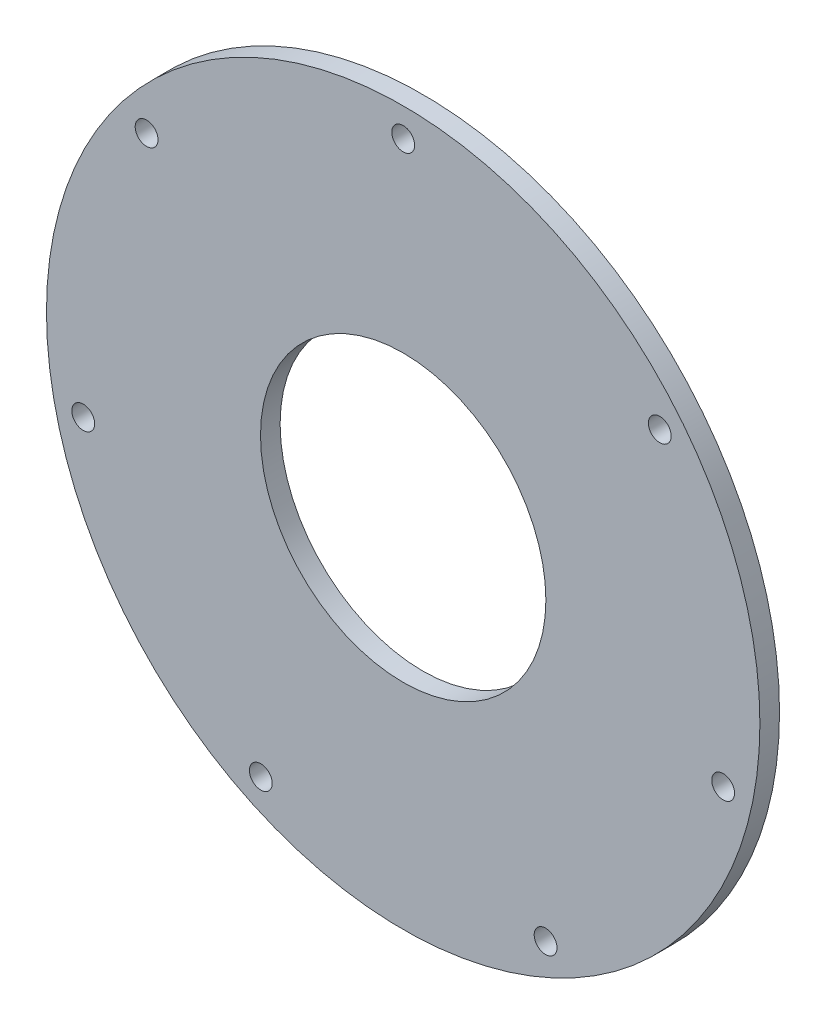
from build123d import *

# Parameters (mm, degrees)
SKIZZE1_R                        = 50
SKIZZE1_R_2                      = 20
AUFSATZ_LINEAR_AUSTRAGEN1_DEPTH  = 2.75
F_3_2_3_2_DURCHMESSER_BOHRUNG1_D = 3.2
KREISMUSTER1_COUNT               = 7


with BuildPart() as part:
    # Skizze1 → Aufsatz-Linear austragen1 (new body)
    with BuildSketch(Plane.XY):
        Circle(SKIZZE1_R)
        Circle(SKIZZE1_R_2, mode=Mode.SUBTRACT)
    extrude(amount=AUFSATZ_LINEAR_AUSTRAGEN1_DEPTH)

    # Ø3.2 (3.2) Durchmesser Bohrung1 (through all)
    with Locations(Plane.XY.offset(2.75)):
        with Locations((0, 46)):
            f_3_2_3_2_durchmesser_bohrung1 = Hole(F_3_2_3_2_DURCHMESSER_BOHRUNG1_D / 2)

    # Kreismuster1: Ø3.2 (3.2) Durchmesser Bohrung1 ×7 about axis
    kreismuster1_axis = Axis((0, 0, 2.75), (0, 0, 1))
    for i in range(1, KREISMUSTER1_COUNT):
        add(f_3_2_3_2_durchmesser_bohrung1.rotate(kreismuster1_axis, i * 360 / KREISMUSTER1_COUNT), mode=Mode.SUBTRACT)


solid = part.part
